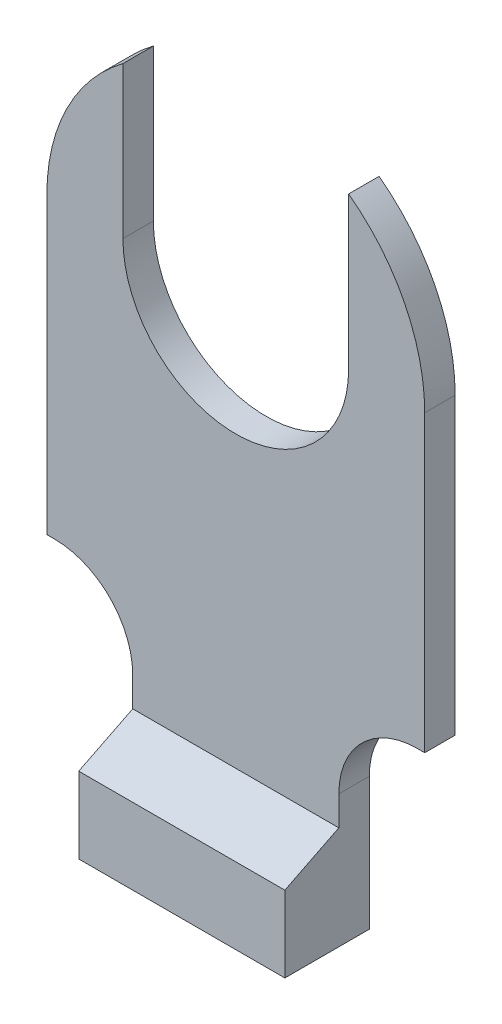
from build123d import *

# Parameters (mm, degrees)
EXTRUDE_1_DEPTH     = 1.24
CUT_EXTRUDE_1_DEPTH = 1.24
SKETCH_4_W          = 8.4
SKETCH_4_H          = 3
EXTRUDE_2_DEPTH     = 2.2
CHAMFER_1_SIZE      = 1.2
CHAMFER_1_SIZE_2    = 2.4


with BuildPart() as part:
    # Эскиз1 → Бобышка-Вытянуть1 (new body)
    with BuildSketch(Plane.XY):
        with BuildLine():
            Line((-4.6, 0), (-4.6, 6.174949393))
            ThreePointArc((-4.6, 6.174949393), (-6.88149693, 3.454706934), (-7.7, 0))
            Line((-7.7, 0), (-7.7, -20.6))
            Line((-7.7, -20.6), (7.7, -20.6))
            Line((7.7, -20.6), (7.7, 0))
            ThreePointArc((7.7, 0), (6.88149693, 3.454706934), (4.6, 6.174949393))
            Line((4.6, 6.174949393), (4.6, 0))
            ThreePointArc((4.6, 0), (0, -4.6), (-4.6, 0))
        make_face()
    extrude(amount=EXTRUDE_1_DEPTH)

    # Эскиз3 → Вырез-Вытянуть1 (cut)
    with BuildSketch(Plane.XY.offset(1.24)):
        with BuildLine():
            Line((-7.7, -20.6), (-4.2, -20.6))
            Line((-4.2, -20.6), (-4.2, -15.2))
            ThreePointArc((-4.2, -15.2), (-5.1372583, -12.9372583), (-7.4, -12))
            Line((-7.4, -12), (-7.7, -12))
            Line((-7.7, -12), (-7.7, -20.6))
        make_face()
        with BuildLine():
            Line((4.2, -20.6), (4.2, -15.2))
            ThreePointArc((4.2, -15.2), (5.1372583, -12.9372583), (7.4, -12))
            Line((7.4, -12), (7.7, -12))
            Line((7.7, -12), (7.7, -20.6))
            Line((7.7, -20.6), (4.2, -20.6))
        make_face()
    extrude(amount=-CUT_EXTRUDE_1_DEPTH, mode=Mode.SUBTRACT)

    # Эскиз4 → Бобышка-Вытянуть2 (add)
    with BuildSketch(Plane.XY.offset(1.24)):
        with Locations((0, -19.1)):
            Rectangle(SKETCH_4_W, SKETCH_4_H)
    extrude(amount=EXTRUDE_2_DEPTH)

    # Фаска1
    # the kernel refuses this chamfer: 2.4, 1.2 mm, written as the material it adds along each edge
    with BuildSketch(Plane(origin=(4.2, -17.6, 1.24), x_dir=(0, 0.9976223042390325, -0.06891834360170876), z_dir=(-1, 0, 0))) as chamfer_1_piece_1_section:
        Polygon((CHAMFER_1_SIZE * 0.997622304239, -CHAMFER_1_SIZE * 0.0689183436017), (-CHAMFER_1_SIZE_2 * 0.0689183436017, -CHAMFER_1_SIZE_2 * 0.997622304239), (0, 0), align=None)
    chamfer_1_piece_1 = extrude(amount=8.4, mode=Mode.PRIVATE)
    chamfer_1_piece_1 = split(chamfer_1_piece_1, bisect_by=Plane(origin=(0, -17.211387721, 3.44), z_dir=(0, 0, -1)), keep=Keep.TOP, mode=Mode.PRIVATE)
    add(chamfer_1_piece_1)


solid = part.part
